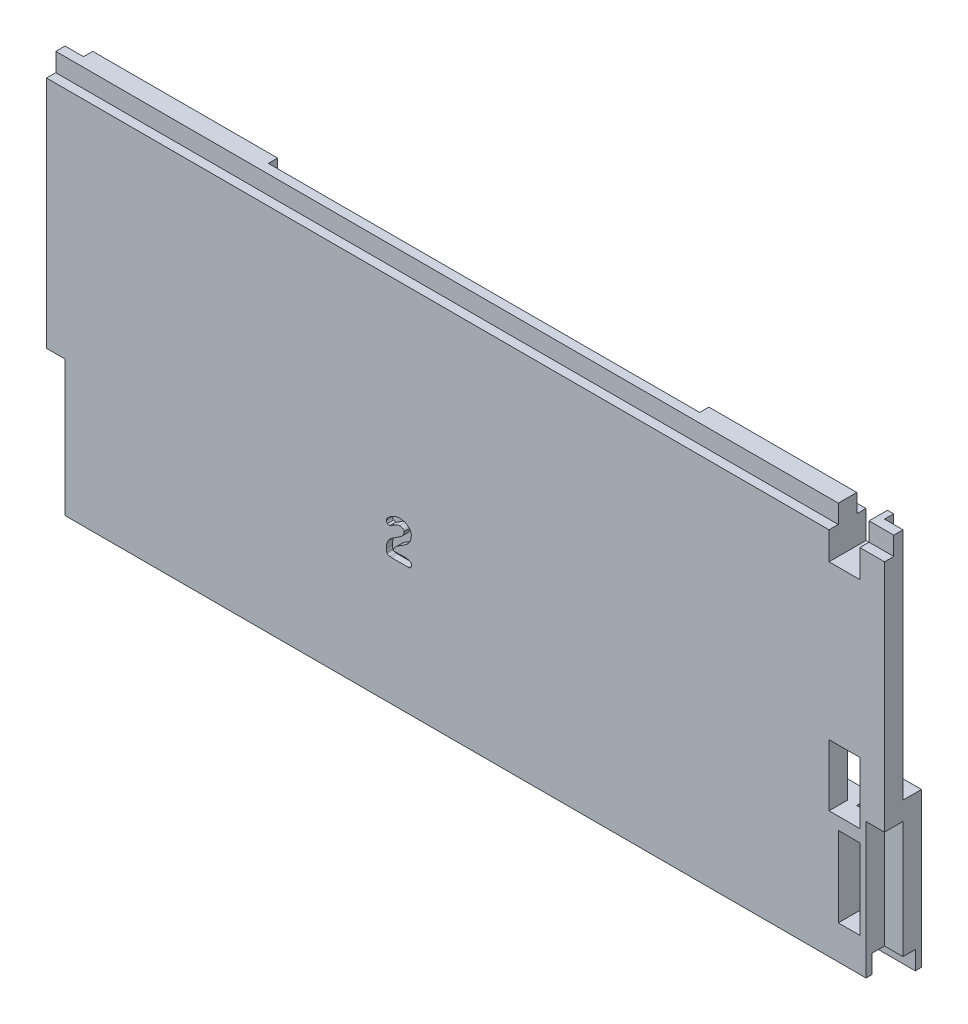
from build123d import *

# Parameters (mm, degrees)
SKETCH_1_W           = 130
SKETCH_1_H           = 60
EXTRUDE_1_DEPTH      = 6
EXTRUDE_2_DEPTH      = 3
EXTRUDE_2_DEPTH_BACK = 133
SKETCH_2_W           = 3
SKETCH_2_H           = 38
SKETCH_3_W           = 136
SKETCH_3_H           = 4
CUT_EXTRUDE_1_DEPTH  = 3
SKETCH_4_W           = 130
SKETCH_4_H           = 1.5
EXTRUDE_3_DEPTH      = 3
SKETCH_5_W           = 70
SKETCH_5_H           = 49.457225718
CUT_EXTRUDE_2_DEPTH  = 3
SKETCH_6_W           = 3.5
SKETCH_6_H           = 13
SKETCH_6_W_2         = 5
SKETCH_6_H_2         = 10
SKETCH_6_H_3         = 16
CUT_EXTRUDE_3_DEPTH  = 65
SKETCH_7_W           = 24
SKETCH_7_H           = 10
SKETCH_7_W_2         = 3.5
SKETCH_7_H_2         = 2
CUT_EXTRUDE_4_DEPTH  = 3
CUT_EXTRUDE_5_DEPTH  = 1
CHAMFER_1_SIZE2      = 3
CHAMFER_1_SIZE       = 10


with BuildPart() as part:
    # 草圖1 → 填料-伸長1 (new body)
    with BuildSketch(Plane.XY):
        with Locations((-8.798209738, -7.779783394)):
            Rectangle(SKETCH_1_W, SKETCH_1_H)
    extrude(amount=EXTRUDE_1_DEPTH)

    # 草圖2 → 填料-伸長2 (add, two sides: drawn at the far end of the back side and taken through both)
    with BuildSketch(Plane.ZY.offset(73.798209738).offset(-EXTRUDE_2_DEPTH_BACK)):
        Polygon((0, -12.779783394), (0, -37.779783394), (3, -37.779783394), (3, -15.779783394), (3, -12.779783394), align=None)
        with Locations((4.5, 3.220216606)):
            Rectangle(SKETCH_2_W, SKETCH_2_H)
    extrude(amount=EXTRUDE_2_DEPTH + EXTRUDE_2_DEPTH_BACK)

    # 草圖3 → 除料-伸長1 (cut)
    with BuildSketch(Plane.XZ.offset(37.779783394)):
        with Locations((-8.798209738, 3)):
            Rectangle(SKETCH_3_W, SKETCH_3_H)
    extrude(amount=-CUT_EXTRUDE_1_DEPTH, mode=Mode.SUBTRACT)

    # 草圖4 → 填料-伸長3 (add)
    with BuildSketch(Plane(origin=(0, 22.220216606, 0), x_dir=(1, 0, 0), z_dir=(0, 1, 0))):
        with Locations((-8.798209738, -2.25)):
            Rectangle(SKETCH_4_W, SKETCH_4_H)
        Polygon((56.201790262, -3), (-73.798209738, -3), (-76.798209738, -3), (-76.798209738, -4.5), (59.201790262, -4.5), (59.201790262, -3), align=None)
    extrude(amount=EXTRUDE_3_DEPTH)

    # 草圖5 → 除料-伸長2 (cut)
    with BuildSketch(Plane(origin=(0, 0, 0), x_dir=(-1, 0, 0), z_dir=(0, 0, -1))):
        with Locations((8.798209738, 3.433561509)):
            Rectangle(SKETCH_5_W, SKETCH_5_H)
    extrude(amount=-CUT_EXTRUDE_2_DEPTH, mode=Mode.SUBTRACT)

    # 草圖6 → 除料-伸長3 (cut)
    with BuildSketch(Plane.XY.offset(6)):
        with Locations((53.451790262, -25.779783394)):
            Rectangle(SKETCH_6_W, SKETCH_6_H)
        with Locations((52.701790262, -12.279783394)):
            Rectangle(SKETCH_6_W_2, SKETCH_6_H_2)
        with Locations((52.701790262, 25.720216606)):
            Rectangle(SKETCH_6_W_2, SKETCH_6_H_3)
    extrude(amount=-CUT_EXTRUDE_3_DEPTH, mode=Mode.SUBTRACT)

    # 草圖7 → 除料-伸長4 (cut)
    with BuildSketch(Plane(origin=(0, 0, 0), x_dir=(-1, 0, 0), z_dir=(0, 0, -1))):
        with Locations((-38.201790262, -12.279783394)):
            Rectangle(SKETCH_7_W, SKETCH_7_H)
        with Locations((-53.451790262, -18.279783394)):
            Rectangle(SKETCH_7_W_2, SKETCH_7_H_2)
    extrude(amount=-CUT_EXTRUDE_4_DEPTH, mode=Mode.SUBTRACT)

    # 草圖8 → 除料-伸長5 (cut)
    with BuildSketch(Plane.XY.offset(6)):
        with BuildLine():
            add(Edge.make_bspline(
                [(-18.069479286, -17.195424399), (-18.088637845, -17.195424399), (-18.131744602, -17.195424399), (-18.203589198, -17.195424399), (-18.289403576, -17.195424399), (-18.384398096, -17.195424399), (-18.478594344, -17.195424399), (-18.562812175, -17.195424399), (-18.631862814, -17.195424399), (-18.672973888, -17.195424399), (-18.690935037, -17.195424399)],
                knots=[0, 0, 0, 0, 0.739884393, 1.664739884, 2.774566474, 4.053949904, 5.333333333, 6.412331407, 7.306358382, 8, 8, 8, 8], degree=3))
            Line((-18.690935037, -17.195424399), (-19.885950141, -17.195424399))
            add(Edge.make_bspline(
                [(-19.885950141, -17.195424399), (-19.915087116, -17.195424399), (-19.979747252, -17.195424399), (-20.086715872, -17.195424399), (-20.213641324, -17.195424399), (-20.353738285, -17.195424399), (-20.494234383, -17.195424399), (-20.621558971, -17.195424399), (-20.730124138, -17.195424399), (-20.795981684, -17.195424399), (-20.825916932, -17.195424399)],
                knots=[0, 0, 0, 0, 0.743949045, 1.650955414, 2.731210191, 3.984713376, 5.228025478, 6.318471338, 7.23566879, 8, 8, 8, 8], degree=3))
            add(Edge.make_bspline(
                [(-20.825916932, -17.195424399), (-20.844312365, -17.19455478), (-20.888162874, -17.192481806), (-20.956198543, -17.180431053), (-21.023766461, -17.165602939), (-21.067338688, -17.163839616), (-21.085754885, -17.163094331)],
                knots=[0, 0, 0, 0, 0.842150557, 2.007494485, 3.157849443, 4, 4, 4, 4], degree=3))
            add(Edge.make_bspline(
                [(-21.085754885, -17.163094331), (-21.114939997, -17.162133647), (-21.171229395, -17.160280773), (-21.252243116, -17.147277104), (-21.326175166, -17.12459584), (-21.392934352, -17.091985849), (-21.452093019, -17.049933009), (-21.503183214, -16.998070099), (-21.548149866, -16.938481818), (-21.570243058, -16.892911848), (-21.581482594, -16.8697289)],
                knots=[0, 0, 0, 0, 1.141457261, 2.201531457, 3.199053039, 4.155658673, 5.095814193, 6.023177886, 6.994325316, 8, 8, 8, 8], degree=3))
            add(Edge.make_bspline(
                [(-21.581482594, -16.8697289), (-21.594490862, -16.834896904), (-21.622892883, -16.758845347), (-21.645265388, -16.626982501), (-21.661119221, -16.47180209), (-21.662283882, -16.359691943), (-21.662906469, -16.299761776)],
                knots=[0, 0, 0, 0, 0.768853306, 1.678700592, 2.759114451, 4, 4, 4, 4], degree=3))
            add(Edge.make_bspline(
                [(-21.662906469, -16.299761776), (-21.662266092, -16.238245978), (-21.661011886, -16.11776474), (-21.642956883, -15.941124783), (-21.617523996, -15.771732565), (-21.579929972, -15.610276418), (-21.534211034, -15.455894447), (-21.474285352, -15.310882065), (-21.406928216, -15.171920469), (-21.352401474, -15.085523397), (-21.32523687, -15.042481356)],
                knots=[0, 0, 0, 0, 1.117262836, 2.188205521, 3.223181786, 4.227752245, 5.19820712, 6.144985786, 7.075852957, 8, 8, 8, 8], degree=3))
            add(Edge.make_bspline(
                [(-21.32523687, -15.042481356), (-21.302502856, -15.009842496), (-21.255604678, -14.942511534), (-21.175353772, -14.845074395), (-21.084566251, -14.747574442), (-20.984553653, -14.649744112), (-20.873781913, -14.552792868), (-20.753355904, -14.455606754), (-20.623662865, -14.357424248), (-20.531640638, -14.294894496), (-20.484655103, -14.262967495)],
                knots=[0, 0, 0, 0, 0.827390267, 1.706829956, 2.623632347, 3.598554096, 4.616564907, 5.685345179, 6.818162778, 8, 8, 8, 8], degree=3))
            add(Edge.make_bspline(
                [(-20.484655103, -14.262967495), (-20.302281643, -14.143975667), (-19.938459803, -13.906595591), (-19.574256086, -13.669801834), (-19.392617253, -13.551706)],
                knots=[0, 0, 0, 0, 1.002542673, 2, 2, 2, 2], degree=3))
            add(Edge.make_bspline(
                [(-19.392617253, -13.551706), (-19.341544927, -13.51395249), (-19.242744589, -13.440917642), (-19.112075083, -13.319228029), (-19.000607667, -13.194637865), (-18.910024294, -13.065496728), (-18.838142469, -12.933245584), (-18.787253342, -12.79628829), (-18.756026878, -12.655064063), (-18.752549003, -12.559209143), (-18.750805533, -12.511156776)],
                knots=[0, 0, 0, 0, 1.19736478, 2.316323856, 3.361882785, 4.345809243, 5.285733081, 6.193496416, 7.094394176, 8, 8, 8, 8], degree=3))
            add(Edge.make_bspline(
                [(-18.750805533, -12.511156776), (-18.754144306, -12.485366819), (-18.76135637, -12.429658074), (-18.816215459, -12.352296488), (-18.899523083, -12.278388639), (-19.008132324, -12.207413401), (-19.130064882, -12.143297171), (-19.256718075, -12.095943245), (-19.382529588, -12.066975127), (-19.466315229, -12.062924864), (-19.507568605, -12.060930644)],
                knots=[0, 0, 0, 0, 0.65585802, 1.416715298, 2.347427229, 3.50115775, 4.718715531, 5.860718497, 6.946686028, 8, 8, 8, 8], degree=3))
            add(Edge.make_bspline(
                [(-19.507568605, -12.060930644), (-19.543960901, -12.062109051), (-19.617575084, -12.064492726), (-19.728319541, -12.083394333), (-19.840471033, -12.113709301), (-19.954255188, -12.155834474), (-20.06951459, -12.210076783), (-20.185966103, -12.276757514), (-20.304673267, -12.354300641), (-20.420582369, -12.443357646), (-20.532807821, -12.531142982), (-20.638455829, -12.609804253), (-20.735227814, -12.675588201), (-20.822534352, -12.729837183), (-20.900319765, -12.772380417), (-20.968643444, -12.802635489), (-21.027569996, -12.82270896), (-21.06448866, -12.825864636), (-21.080965246, -12.827272996)],
                knots=[0, 0, 0, 0, 0.980529079, 1.983410101, 3.019501481, 4.108748668, 5.249436972, 6.449129478, 7.723311378, 9.068163484, 10.387336586, 11.564382619, 12.617758153, 13.540385509, 14.334645644, 15.00429017, 15.555620488, 16, 16, 16, 16], degree=3))
            add(Edge.make_bspline(
                [(-21.080965246, -12.827272996), (-21.115772478, -12.825736484), (-21.183926005, -12.822727952), (-21.28301068, -12.803737852), (-21.375673628, -12.770077212), (-21.431454313, -12.737162249), (-21.459346782, -12.720703513)],
                knots=[0, 0, 0, 0, 1.048304771, 2.052609862, 3.026230728, 4, 4, 4, 4], degree=3))
            add(Edge.make_bspline(
                [(-21.459346782, -12.720703513), (-21.490346137, -12.698287573), (-21.550436604, -12.654835564), (-21.614592352, -12.565472882), (-21.656174115, -12.464310885), (-21.660608729, -12.391843928), (-21.662906469, -12.354296076)],
                knots=[0, 0, 0, 0, 1.042856759, 2.021517852, 2.974874083, 4, 4, 4, 4], degree=3))
            add(Edge.make_bspline(
                [(-21.662906469, -12.354296076), (-21.660283542, -12.313684398), (-21.655105264, -12.233507321), (-21.616131766, -12.117878225), (-21.551655645, -12.011221937), (-21.491522598, -11.952356482), (-21.460544192, -11.922031093)],
                knots=[0, 0, 0, 0, 0.989516236, 1.953539581, 2.9457364, 4, 4, 4, 4], degree=3))
            add(Edge.make_bspline(
                [(-21.460544192, -11.922031093), (-21.382297379, -11.852435486), (-21.23350612, -11.72009504), (-21.009729239, -11.546370066), (-20.805415792, -11.39719742), (-20.668509873, -11.317528675), (-20.604396096, -11.280219374)],
                knots=[0, 0, 0, 0, 1.171732278, 2.228122971, 3.17022047, 4, 4, 4, 4], degree=3))
            add(Edge.make_bspline(
                [(-20.604396096, -11.280219374), (-20.56031611, -11.257022217), (-20.473229448, -11.211192734), (-20.339647228, -11.150734667), (-20.204381238, -11.100433811), (-20.06776552, -11.060135529), (-19.930833207, -11.027126763), (-19.79238123, -11.004374037), (-19.652714883, -10.991164332), (-19.55908424, -10.989087692), (-19.512358245, -10.988051352)],
                knots=[0, 0, 0, 0, 1.046005916, 2.066542525, 3.077115015, 4.074352844, 5.05643091, 6.03352332, 7.018637735, 8, 8, 8, 8], degree=3))
            add(Edge.make_bspline(
                [(-19.512358245, -10.988051352), (-19.454448439, -10.989294224), (-19.339983051, -10.991750903), (-19.170611732, -11.008502224), (-19.005955487, -11.037844384), (-18.84460346, -11.076575942), (-18.688663697, -11.129980837), (-18.536309929, -11.19233433), (-18.38835688, -11.266484042), (-18.29416505, -11.324979371), (-18.246695955, -11.354458789)],
                knots=[0, 0, 0, 0, 1.0399929, 2.055665494, 3.052650648, 4.041875031, 5.032448971, 6.009522346, 6.996875068, 8, 8, 8, 8], degree=3))
            add(Edge.make_bspline(
                [(-18.246695955, -11.354458789), (-18.19570589, -11.389834528), (-18.096601525, -11.458590867), (-17.963277765, -11.574791874), (-17.852836353, -11.701866924), (-17.760208411, -11.835342022), (-17.689023049, -11.977762024), (-17.638556269, -12.128488177), (-17.605972765, -12.287039106), (-17.602866288, -12.396044953), (-17.601292006, -12.45128628)],
                knots=[0, 0, 0, 0, 1.118339495, 2.17360629, 3.178099351, 4.146054994, 5.095323729, 6.037338194, 7.005374065, 8, 8, 8, 8], degree=3))
            add(Edge.make_bspline(
                [(-17.601292006, -12.45128628), (-17.602219506, -12.507190714), (-17.604044542, -12.617193469), (-17.618226264, -12.77932461), (-17.643948895, -12.93468834), (-17.676682857, -13.08432831), (-17.721624032, -13.226973484), (-17.774915013, -13.36396662), (-17.840041075, -13.493669352), (-17.890094771, -13.575585272), (-17.915013406, -13.616366136)],
                knots=[0, 0, 0, 0, 1.09630341, 2.157188377, 3.187960365, 4.183013372, 5.158477418, 6.117822738, 7.06298049, 8, 8, 8, 8], degree=3))
            add(Edge.make_bspline(
                [(-17.915013406, -13.616366136), (-17.960171455, -13.681063279), (-18.05452931, -13.816248119), (-18.234010932, -14.002742232), (-18.446162962, -14.188902642), (-18.605992898, -14.302717774), (-18.689737627, -14.362352519)],
                knots=[0, 0, 0, 0, 0.873724977, 1.825650506, 2.860724628, 4, 4, 4, 4], degree=3))
            add(Edge.make_bspline(
                [(-18.689737627, -14.362352519), (-18.85694762, -14.467769497), (-19.191653367, -14.67878361), (-19.526698808, -14.889257944), (-19.694364553, -14.994584959)],
                knots=[0, 0, 0, 0, 0.999146234, 2, 2, 2, 2], degree=3))
            add(Edge.make_bspline(
                [(-19.694364553, -14.994584959), (-19.75496494, -15.035499688), (-19.872223408, -15.114667473), (-20.030259937, -15.245575994), (-20.167373003, -15.379612078), (-20.280746386, -15.519888997), (-20.374084857, -15.663393732), (-20.444530649, -15.812233911), (-20.492619814, -15.965531707), (-20.506488979, -16.0703616), (-20.513392942, -16.122545107)],
                knots=[0, 0, 0, 0, 1.214785791, 2.350544756, 3.406114953, 4.396695574, 5.342656762, 6.24489036, 7.126320029, 8, 8, 8, 8], degree=3))
            add(Edge.make_bspline(
                [(-20.513392942, -16.122545107), (-20.471893855, -16.118812869), (-20.380573148, -16.110599902), (-20.23001583, -16.100430735), (-20.053648285, -16.088067547), (-19.927071452, -16.080876366), (-19.859607123, -16.07704353)],
                knots=[0, 0, 0, 0, 0.762872657, 1.678737463, 2.762787659, 4, 4, 4, 4], degree=3))
            add(Edge.make_bspline(
                [(-19.859607123, -16.07704353), (-19.790559154, -16.074568948), (-19.65765901, -16.069805995), (-19.465647872, -16.064206594), (-19.289250785, -16.058024273), (-19.12801768, -16.052669244), (-18.981901682, -16.050873575), (-18.850983489, -16.048680532), (-18.735253406, -16.045352962), (-18.663396482, -16.045733369), (-18.629867131, -16.045910872)],
                knots=[0, 0, 0, 0, 1.347923746, 2.594417539, 3.747519198, 4.791413166, 5.741528579, 6.598216494, 7.345910061, 8, 8, 8, 8], degree=3))
            add(Edge.make_bspline(
                [(-18.629867131, -16.045910872), (-18.57187214, -16.047794993), (-18.456034984, -16.051558271), (-18.283279731, -16.080899143), (-18.11099066, -16.12521846), (-17.999986103, -16.170335845), (-17.943751244, -16.193192293)],
                knots=[0, 0, 0, 0, 0.984642327, 1.966689949, 2.969926037, 4, 4, 4, 4], degree=3))
            add(Edge.make_bspline(
                [(-17.943751244, -16.193192293), (-17.910794187, -16.208677986), (-17.848038488, -16.238165313), (-17.761529444, -16.28797499), (-17.69028293, -16.34395347), (-17.628193665, -16.399375254), (-17.58243541, -16.461395334), (-17.549468971, -16.526110421), (-17.527380923, -16.59409657), (-17.525569018, -16.641254869), (-17.524657771, -16.664971803)],
                knots=[0, 0, 0, 0, 1.306237184, 2.487292045, 3.569727768, 4.552200152, 5.462774202, 6.314372767, 7.152261392, 8, 8, 8, 8], degree=3))
            add(Edge.make_bspline(
                [(-17.524657771, -16.664971803), (-17.526517089, -16.698692431), (-17.530168305, -16.76491093), (-17.558835357, -16.861037654), (-17.607694833, -16.949924703), (-17.652549773, -17.001408853), (-17.675531421, -17.02778701)],
                knots=[0, 0, 0, 0, 1.003331592, 1.970281001, 2.960063501, 4, 4, 4, 4], degree=3))
            add(Edge.make_bspline(
                [(-17.675531421, -17.02778701), (-17.702498255, -17.053383255), (-17.755474968, -17.103667428), (-17.851692525, -17.157325429), (-17.957704548, -17.189261753), (-18.031737711, -17.193343536), (-18.069479286, -17.195424399)],
                knots=[0, 0, 0, 0, 1.01023219, 1.98461489, 2.972571133, 4, 4, 4, 4], degree=3))
        make_face()
    extrude(amount=-CUT_EXTRUDE_5_DEPTH, mode=Mode.SUBTRACT)

    # 導角1
    chamfer_1_edges = [part.edges().sort_by_distance(p)[0] for p in [
        (-8.798209738, -21.29505135, 0),
    ]]
    chamfer_1_side = [part.faces().sort_by_distance(p)[0] for p in [
        (-8.798209738, -21.35505135, 0),
    ]]
    chamfer(chamfer_1_edges, length=CHAMFER_1_SIZE - 0.0001, length2=CHAMFER_1_SIZE2 - 0.0001, reference=chamfer_1_side[0])  # a hair under: the kernel refuses the full size


solid = part.part
